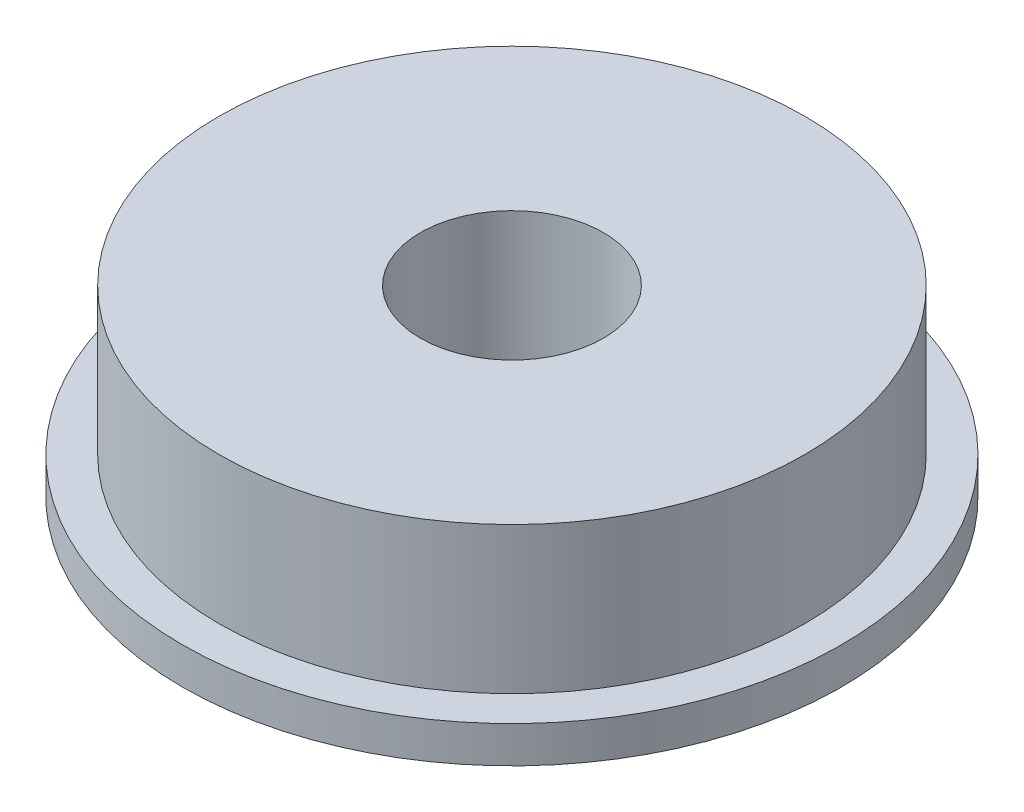
from build123d import *

# Parameters (mm, degrees)
SKETCH_1_R      = 9
SKETCH_1_R_2    = 2.5
EXTRUDE_1_DEPTH = 1
SKETCH_2_R      = 8
SKETCH_2_R_2    = 2.5
EXTRUDE_2_DEPTH = 4


with BuildPart() as part:
    # Эскиз1 → Бобышка-Вытянуть1 (new body)
    with BuildSketch(Plane(origin=(0, 0, 0), x_dir=(1, 0, 0), z_dir=(0, 1, 0))):
        Circle(SKETCH_1_R)
        Circle(SKETCH_1_R_2, mode=Mode.SUBTRACT)
    extrude(amount=EXTRUDE_1_DEPTH)

    # Эскиз2 → Бобышка-Вытянуть2 (add)
    with BuildSketch(Plane(origin=(0, 1, 0), x_dir=(1, 0, 0), z_dir=(0, 1, 0))):
        Circle(SKETCH_2_R)
        Circle(SKETCH_2_R_2, mode=Mode.SUBTRACT)
    extrude(amount=EXTRUDE_2_DEPTH)


solid = part.part
